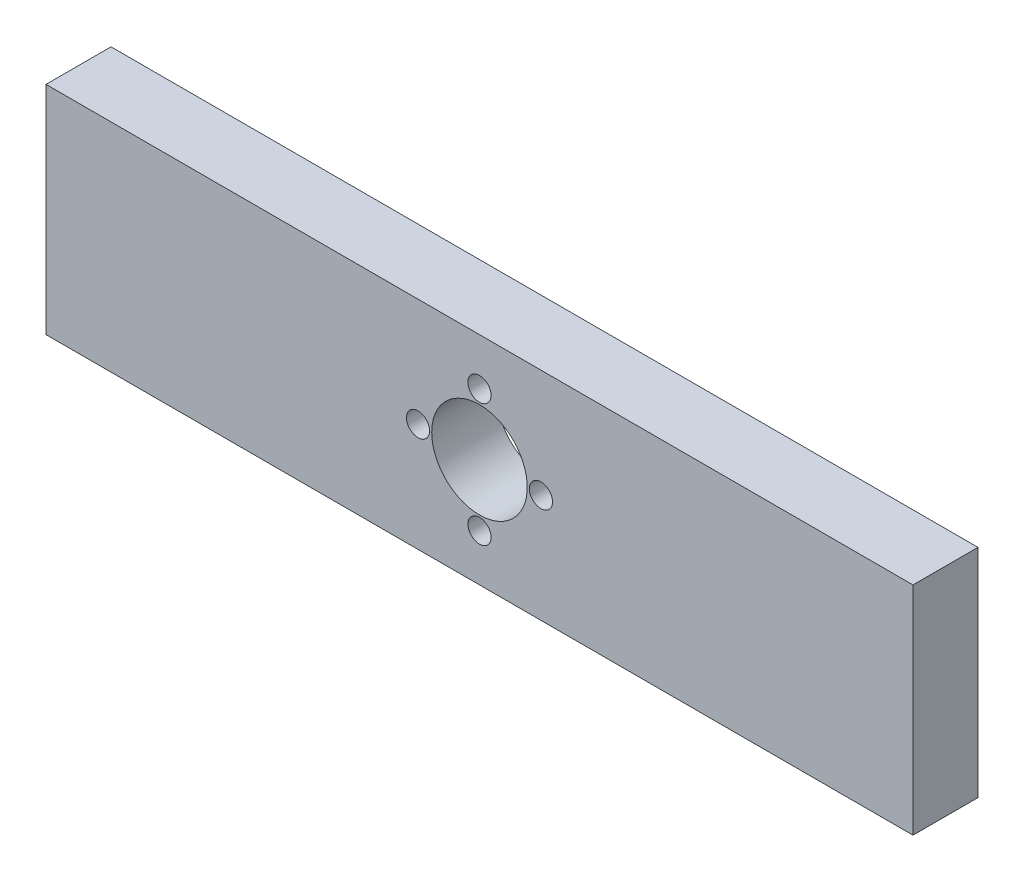
from build123d import *

# Parameters (mm, degrees)
SKETCH1_W           = 127
SKETCH1_H           = 31.75
SKETCH1_R           = 1.7
SKETCH1_R_2         = 7
BOSS_EXTRUDE1_DEPTH = 9.525


with BuildPart() as part:
    # Sketch1 → Boss-Extrude1 (new body)
    with BuildSketch(Plane.XY):
        Rectangle(SKETCH1_W, SKETCH1_H)
        with Locations((0, -9)):
            Circle(SKETCH1_R, mode=Mode.SUBTRACT)
        with Locations((-9, 0)):
            Circle(SKETCH1_R, mode=Mode.SUBTRACT)
        with Locations((0, 9)):
            Circle(SKETCH1_R, mode=Mode.SUBTRACT)
        with Locations((9, 0)):
            Circle(SKETCH1_R, mode=Mode.SUBTRACT)
        Circle(SKETCH1_R_2, mode=Mode.SUBTRACT)
    extrude(amount=BOSS_EXTRUDE1_DEPTH)


solid = part.part
